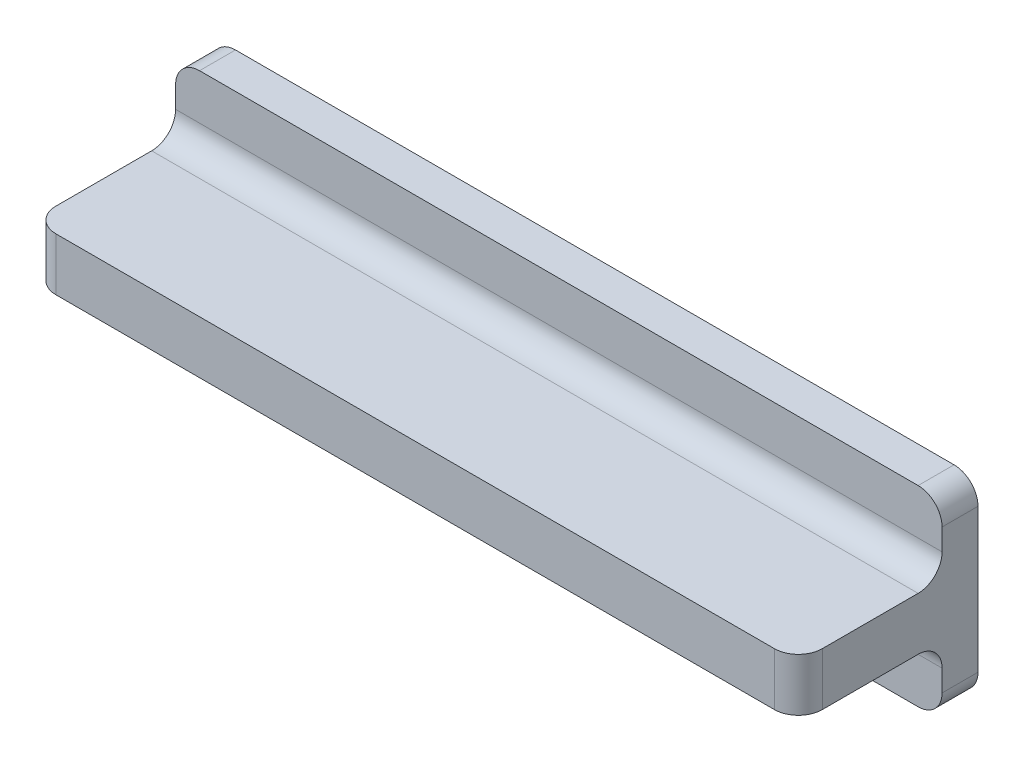
from build123d import *

# Parameters (mm, degrees)
SKETCH1_W           = 101.6
SKETCH1_H           = 25.4
BOSS_EXTRUDE1_DEPTH = 4.7625
SKETCH2_W           = 101.6
SKETCH2_H           = 7
BOSS_EXTRUDE2_DEPTH = 19.05
FILLET1_R           = 3.175


with BuildPart() as part:
    # Sketch1 → Boss-Extrude1 (new body)
    with BuildSketch(Plane.XY):
        Rectangle(SKETCH1_W, SKETCH1_H)
    extrude(amount=BOSS_EXTRUDE1_DEPTH)

    # Sketch2 → Boss-Extrude2 (add)
    with BuildSketch(Plane.XY.offset(4.7625)):
        Rectangle(SKETCH2_W, SKETCH2_H)
    extrude(amount=BOSS_EXTRUDE2_DEPTH)

    # Fillet1
    fillet1_edges = [part.edges().sort_by_distance(p)[0] for p in [
        (0, 3.5, 4.7625),
        (0, -3.5, 4.7625),
        (-50.8, 0, 23.8125),
        (50.8, 0, 23.8125),
        (50.8, 12.7, 2.38125),
        (50.8, -12.7, 2.38125),
        (-50.8, 12.7, 2.38125),
        (-50.8, -12.7, 2.38125),
    ]]
    fillet(fillet1_edges, radius=FILLET1_R)


solid = part.part
